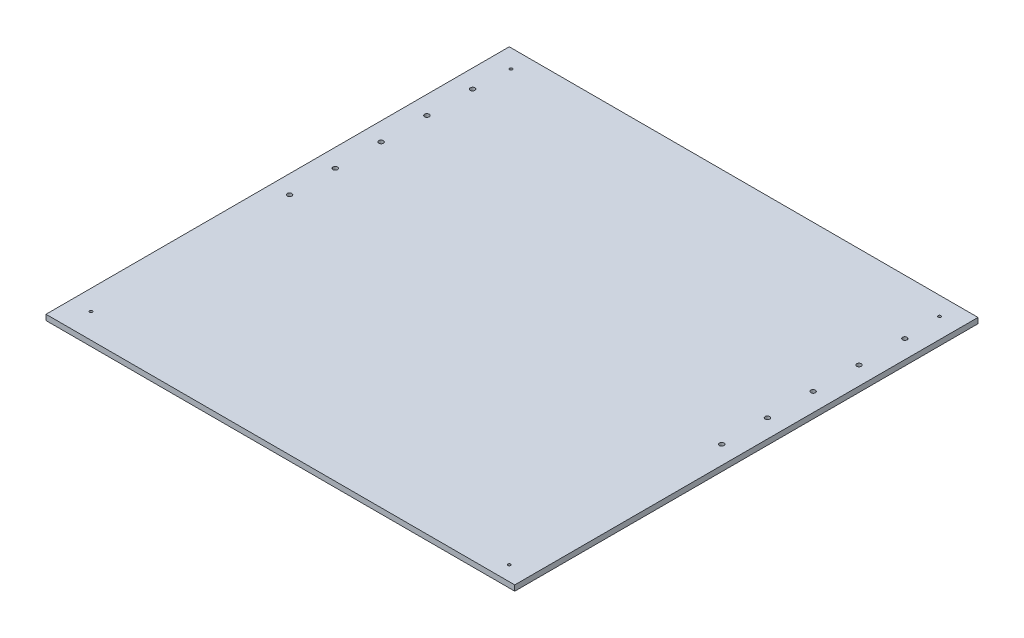
from build123d import *

# Parameters (mm, degrees)
SKETCH1_W           = 500
SKETCH1_H           = 500
SKETCH1_R           = 1.525
SKETCH1_R_2         = 1.5
BOSS_EXTRUDE1_DEPTH = 6
BOSS_EXTRUDE2_DEPTH = 6
SKETCH3_R           = 2.5
CUT_EXTRUDE1_DEPTH  = 716.617216115


with BuildPart() as part:
    # Sketch1 → Boss-Extrude1 (new body)
    with BuildSketch(Plane(origin=(0, 0, 0), x_dir=(1, 0, 0), z_dir=(0, 1, 0))):
        with Locations((250, -250)):
            Rectangle(SKETCH1_W, SKETCH1_H)
        with Locations((484, -20)):
            Circle(SKETCH1_R, mode=Mode.SUBTRACT)
        with Locations((16, -20)):
            Circle(SKETCH1_R_2, mode=Mode.SUBTRACT)
        with Locations((16, -478.791393797)):
            Circle(SKETCH1_R_2, mode=Mode.SUBTRACT)
        with Locations((484, -490)):
            Circle(SKETCH1_R_2, mode=Mode.SUBTRACT)
    extrude(amount=BOSS_EXTRUDE1_DEPTH)

    # Sketch2 → Boss-Extrude2 (add)
    with BuildSketch(Plane.XZ):
        Polygon((-6, 506), (-6, 0), (0, 0), (0, 500), (500, 500), (500, 0), (506, 0), (506, 506), align=None)
    extrude(amount=-BOSS_EXTRUDE2_DEPTH)

    # Sketch3 → Cut-Extrude1 (cut, through all)
    with BuildSketch(Plane.XZ):
        with Locations((14, 60)):
            Circle(SKETCH3_R)
        with Locations((14, 110)):
            Circle(SKETCH3_R)
        with Locations((14, 160)):
            Circle(SKETCH3_R)
        with Locations((14, 210)):
            Circle(SKETCH3_R)
        with Locations((14, 260)):
            Circle(SKETCH3_R)
        with Locations((486, 60)):
            Circle(SKETCH3_R)
        with Locations((486, 110)):
            Circle(SKETCH3_R)
        with Locations((486, 160)):
            Circle(SKETCH3_R)
        with Locations((486, 210)):
            Circle(SKETCH3_R)
        with Locations((486, 260)):
            Circle(SKETCH3_R)
    extrude(amount=-CUT_EXTRUDE1_DEPTH, mode=Mode.SUBTRACT)


solid = part.part
